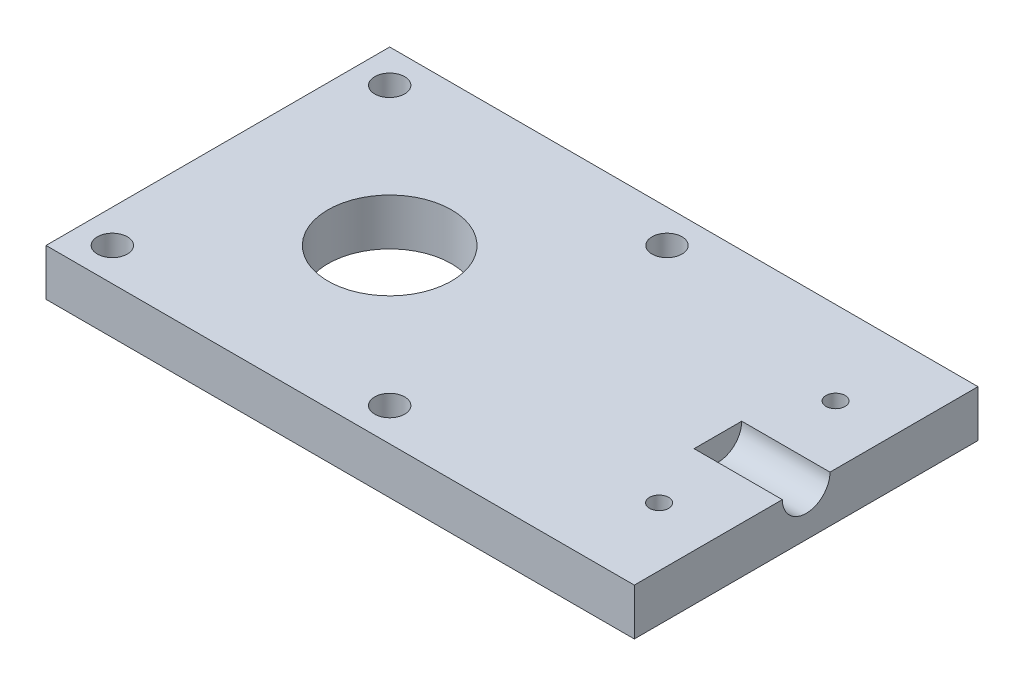
from build123d import *

# Parameters (mm, degrees)
SKETCH1_W           = 100
SKETCH1_H           = 58.42
SKETCH1_R           = 2.55
SKETCH1_R_2         = 1.625
SKETCH1_R_3         = 10.5
BOSS_EXTRUDE1_DEPTH = 7.9375
SKETCH2_R           = 4.05
CUT_EXTRUDE1_DEPTH  = 15


with BuildPart() as part:
    # Sketch1 → Boss-Extrude1 (new body)
    with BuildSketch(Plane.XZ.offset(110.068674648)):
        with Locations((45.506748586, 71.609111908)):
            Rectangle(SKETCH1_W, SKETCH1_H)
        with Locations((1.146748586, 95.179111908)):
            Circle(SKETCH1_R, mode=Mode.SUBTRACT)
        with Locations((1.146748586, 48.039111908)):
            Circle(SKETCH1_R, mode=Mode.SUBTRACT)
        with Locations((48.286748586, 48.039111908)):
            Circle(SKETCH1_R, mode=Mode.SUBTRACT)
        with Locations((48.286748586, 95.179111908)):
            Circle(SKETCH1_R, mode=Mode.SUBTRACT)
        with Locations((85.506748586, 86.609111908)):
            Circle(SKETCH1_R_2, mode=Mode.SUBTRACT)
        with Locations((85.506748586, 56.609111908)):
            Circle(SKETCH1_R_2, mode=Mode.SUBTRACT)
        with Locations((24.716748586, 71.609111908)):
            Circle(SKETCH1_R_3, mode=Mode.SUBTRACT)
    extrude(amount=BOSS_EXTRUDE1_DEPTH)

    # Sketch2 → Cut-Extrude1 (cut)
    with BuildSketch(Plane(origin=(95.506748586, -1.5875, 13.918119016), x_dir=(0, 0, -1), z_dir=(1, 0, 0))):
        with Locations((-57.690992892, -108.481174648)):
            Circle(SKETCH2_R)
    extrude(amount=-CUT_EXTRUDE1_DEPTH, mode=Mode.SUBTRACT)


solid = part.part
